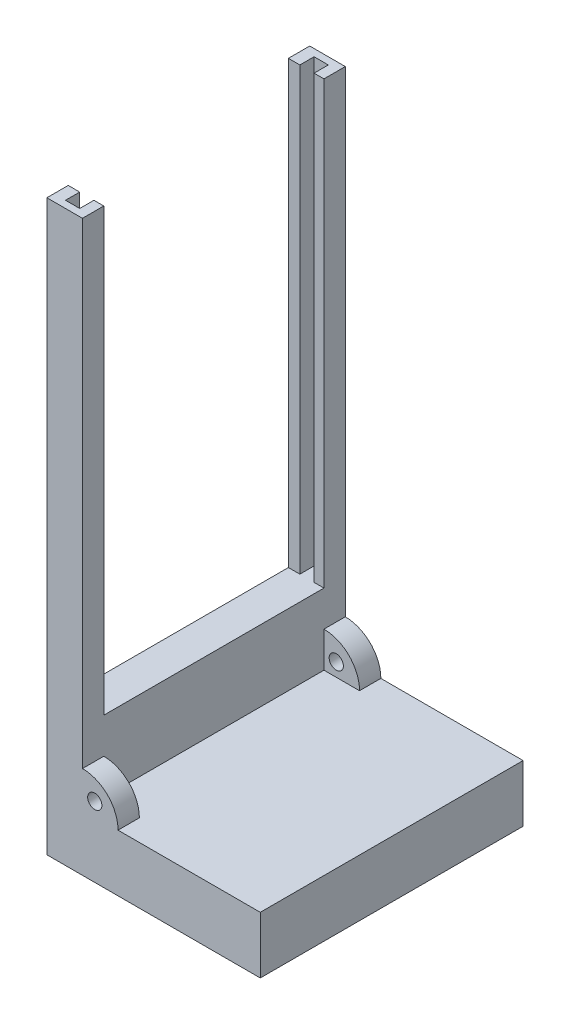
from build123d import *

# Parameters (mm, degrees)
SKETCH1_W           = 369.515011548
SKETCH1_H           = 800
BOSS_EXTRUDE1_DEPTH = 80
SKETCH2_W           = 369.515011548
SKETCH2_H           = 80
BOSS_EXTRUDE2_DEPTH = 250
SKETCH3_W           = 50
SKETCH3_H           = 50
BOSS_EXTRUDE3_DEPTH = 30
SKETCH4_W           = 50
SKETCH4_H           = 50
BOSS_EXTRUDE4_DEPTH = 30
SKETCH5_W           = 309.515011548
SKETCH5_H           = 650
CUT_EXTRUDE1_DEPTH  = 507.591883018
SKETCH6_W           = 369.515011548
SKETCH6_H           = 800
CUT_EXTRUDE2_DEPTH  = 30
SKETCH7_W           = 20
SKETCH7_H           = 620
CUT_EXTRUDE3_DEPTH  = 20
FILLET1_R           = 50
SKETCH8_R           = 10
CUT_EXTRUDE4_DEPTH  = 637.742761057
CUT_EXTRUDE5_DEPTH  = 10


with BuildPart() as part:
    # Sketch1 → Boss-Extrude1 (new body)
    with BuildSketch(Plane(origin=(0, 0, 0), x_dir=(0, 0, -1), z_dir=(1, 0, 0))):
        Rectangle(SKETCH1_W, SKETCH1_H)
    extrude(amount=BOSS_EXTRUDE1_DEPTH)

    # Sketch2 → Boss-Extrude2 (add)
    with BuildSketch(Plane(origin=(80, 0, 0), x_dir=(0, 0, -1), z_dir=(1, 0, 0))):
        with Locations((0, -360)):
            Rectangle(SKETCH2_W, SKETCH2_H)
    extrude(amount=BOSS_EXTRUDE2_DEPTH)

    # Sketch3 → Boss-Extrude3 (add)
    with BuildSketch(Plane(origin=(0, 0, -184.757505774), x_dir=(-1, 0, 0), z_dir=(0, 0, -1))):
        with Locations((-105, -295)):
            Rectangle(SKETCH3_W, SKETCH3_H)
    extrude(amount=-BOSS_EXTRUDE3_DEPTH)

    # Sketch4 → Boss-Extrude4 (add)
    with BuildSketch(Plane.XY.offset(184.757505774)):
        with Locations((105, -295)):
            Rectangle(SKETCH4_W, SKETCH4_H)
    extrude(amount=-BOSS_EXTRUDE4_DEPTH)

    # Sketch5 → Cut-Extrude1 (cut, through all)
    with BuildSketch(Plane(origin=(80, 0, 0), x_dir=(0, 0, -1), z_dir=(1, 0, 0))):
        with Locations((0, 105)):
            Rectangle(SKETCH5_W, SKETCH5_H)
    extrude(amount=-CUT_EXTRUDE1_DEPTH, mode=Mode.SUBTRACT)

    # Sketch6 → Cut-Extrude2 (cut)
    with BuildSketch(Plane.ZY):
        Rectangle(SKETCH6_W, SKETCH6_H)
    extrude(amount=-CUT_EXTRUDE2_DEPTH, mode=Mode.SUBTRACT)

    # Sketch7 → Cut-Extrude3 (cut)
    with BuildSketch(Plane(origin=(0, 0, 154.757505774), x_dir=(-1, 0, 0), z_dir=(0, 0, -1))):
        with Locations((-56.133818704, 90)):
            Rectangle(SKETCH7_W, SKETCH7_H)
    cut_extrude3 = extrude(amount=-CUT_EXTRUDE3_DEPTH, mode=Mode.SUBTRACT)

    # Mirror1: Cut-Extrude3 across plane
    add(cut_extrude3.mirror(Plane.XY), mode=Mode.SUBTRACT)

    # Fillet1
    fillet1_edges = [part.edges().sort_by_distance(p)[0] for p in [
        (130, -270, 169.757505774),
        (130, -270, -169.757505774),
    ]]
    fillet(fillet1_edges, radius=FILLET1_R - 0.0001)  # a hair under: the kernel refuses the full size

    # Sketch8 → Cut-Extrude4 (cut, through all)
    with BuildSketch(Plane(origin=(0, 0, -184.757505774), x_dir=(-1, 0, 0), z_dir=(0, 0, -1))):
        with Locations(Location((-97.304869152, -301.216000224, 0), (0, 0, 90))):
            Circle(SKETCH8_R)
    extrude(amount=-CUT_EXTRUDE4_DEPTH, mode=Mode.SUBTRACT)

    # Sketch9 → Cut-Extrude5 (cut)
    # profile 1 of 6: a face of its own
    with BuildSketch(Plane.ZY.offset(-30)):
        with BuildLine():
            Line((-80.52924599, -289.320103921), (-80.52924599, -294.904029521))
            Line((-80.52924599, -294.904029521), (-81.15743762, -294.904029521))
            add(Edge.make_bspline(
                [(-81.15743762, -294.904029521), (-81.413574392, -294.909873211), (-81.881949181, -294.920559054), (-82.518671526, -295.01445331), (-83.009872361, -295.193475663), (-83.401812393, -295.45647266), (-83.633732743, -295.911747878), (-83.77293967, -296.527311888), (-83.863885332, -297.347529546), (-83.873974769, -297.9633239), (-83.87960135, -298.306734184)],
                knots=[0, 0, 0, 0, 1.170341667, 2.140100881, 2.922261751, 3.549365504, 4.239834367, 5.187221071, 6.431396451, 8, 8, 8, 8], degree=3))
            Line((-83.87960135, -298.306734184), (-83.87960135, -305.513488162))
            Line((-83.87960135, -305.513488162), (-72.711750149, -305.513488162))
            Line((-72.711750149, -305.513488162), (-72.711750149, -298.306734184))
            add(Edge.make_bspline(
                [(-72.711750149, -298.306734184), (-72.717756838, -297.963394695), (-72.728527876, -297.347727287), (-72.815562595, -296.526015241), (-72.965604493, -295.910203153), (-73.207677304, -295.455009043), (-73.606359428, -295.19597845), (-74.0985174, -295.013834996), (-74.735690903, -294.920767956), (-75.203992037, -294.909947065), (-75.46008853, -294.904029521)],
                knots=[0, 0, 0, 0, 1.564511131, 2.805440511, 3.753787037, 4.449178313, 5.085362303, 5.86548255, 6.832711704, 8, 8, 8, 8], degree=3))
            Line((-75.46008853, -294.904029521), (-76.062105509, -294.904029521))
            Line((-76.062105509, -294.904029521), (-76.062105509, -289.320103921))
            Line((-76.062105509, -289.320103921), (-53.726403108, -289.320103921))
            Line((-53.726403108, -289.320103921), (-53.726403108, -294.904029521))
            Line((-53.726403108, -294.904029521), (-55.863999627, -294.904029521))
            add(Edge.make_bspline(
                [(-55.863999627, -294.904029521), (-56.198468051, -294.910634354), (-56.802254166, -294.922557471), (-57.617456501, -295.005046872), (-58.234184925, -295.17131606), (-58.715407673, -295.411134441), (-59.013794603, -295.861836088), (-59.181820064, -296.486796078), (-59.302638072, -297.322162531), (-59.307575336, -297.954241664), (-59.310328708, -298.306734184)],
                knots=[0, 0, 0, 0, 1.359249953, 2.453733113, 3.313690376, 3.953962847, 4.580132613, 5.435616196, 6.56991623, 8, 8, 8, 8], degree=3))
            Line((-59.310328708, -298.306734184), (-59.310328708, -320.380690073))
            add(Edge.make_bspline(
                [(-59.310328708, -320.380690073), (-59.307490138, -320.744720646), (-59.302382213, -321.399783021), (-59.181167017, -322.270348771), (-59.013065313, -322.923957755), (-58.722954044, -323.405175662), (-58.23495632, -323.656314607), (-57.618504333, -323.831317882), (-56.802786867, -323.924699637), (-56.198529406, -323.934832741), (-55.863999627, -323.940442643)],
                knots=[0, 0, 0, 0, 1.444986881, 2.600211651, 3.481122194, 4.122029754, 4.75412861, 5.598518326, 6.670488681, 8, 8, 8, 8], degree=3))
            Line((-55.863999627, -323.940442643), (-53.726403108, -323.940442643))
            Line((-53.726403108, -323.940442643), (-53.726403108, -329.524368244))
            Line((-53.726403108, -329.524368244), (-76.062105509, -329.524368244))
            Line((-76.062105509, -329.524368244), (-76.062105509, -323.940442643))
            Line((-76.062105509, -323.940442643), (-75.46008853, -323.940442643))
            add(Edge.make_bspline(
                [(-75.46008853, -323.940442643), (-75.206640119, -323.935739606), (-74.743137858, -323.92713877), (-74.113123667, -323.819945929), (-73.618558733, -323.633492364), (-73.225287202, -323.349298341), (-72.970339825, -322.881923123), (-72.827003452, -322.232330425), (-72.725066545, -321.378446265), (-72.716491031, -320.735909617), (-72.711750149, -320.380690073)],
                knots=[0, 0, 0, 0, 1.127981357, 2.062833636, 2.830046389, 3.467313527, 4.175874923, 5.140314235, 6.419053172, 8, 8, 8, 8], degree=3))
            Line((-72.711750149, -320.380690073), (-72.711750149, -311.097413762))
            Line((-72.711750149, -311.097413762), (-83.87960135, -311.097413762))
            Line((-83.87960135, -311.097413762), (-83.87960135, -320.380690073))
            add(Edge.make_bspline(
                [(-83.87960135, -320.380690073), (-83.87332423, -320.735647516), (-83.861975895, -321.377371156), (-83.776558725, -322.233724562), (-83.626477045, -322.878485857), (-83.38461309, -323.35167521), (-82.991506635, -323.630768401), (-82.502603814, -323.822135889), (-81.874092924, -323.926553039), (-81.410781616, -323.935532545), (-81.15743762, -323.940442643)],
                knots=[0, 0, 0, 0, 1.584921005, 2.86536118, 3.832224895, 4.536010505, 5.174879603, 5.931980822, 6.869183128, 8, 8, 8, 8], degree=3))
            Line((-81.15743762, -323.940442643), (-80.52924599, -323.940442643))
            Line((-80.52924599, -323.940442643), (-80.52924599, -329.524368244))
            Line((-80.52924599, -329.524368244), (-102.864948391, -329.524368244))
            Line((-102.864948391, -329.524368244), (-102.864948391, -323.940442643))
            Line((-102.864948391, -323.940442643), (-100.74480164, -323.940442643))
            add(Edge.make_bspline(
                [(-100.74480164, -323.940442643), (-100.422003706, -323.932919392), (-99.836037888, -323.919262649), (-99.042528449, -323.845777338), (-98.431370031, -323.691914944), (-98.017414176, -323.512208645), (-97.789499261, -323.281937277), (-97.649795124, -323.05537615), (-97.530498169, -322.766820489), (-97.435429653, -322.411995948), (-97.371005024, -321.993393897), (-97.319615598, -321.513003602), (-97.28267883, -320.968720141), (-97.281596318, -320.584339309), (-97.281022791, -320.380690073)],
                knots=[0, 0, 0, 0, 1.913556319, 3.473623831, 4.702143021, 5.649843125, 6.088398027, 6.599755281, 7.217327896, 7.93203303, 8.770386788, 9.723551885, 10.793912496, 12, 12, 12, 12], degree=3))
            Line((-97.281022791, -320.380690073), (-97.281022791, -298.306734184))
            add(Edge.make_bspline(
                [(-97.281022791, -298.306734184), (-97.28392296, -297.951401117), (-97.289128129, -297.313655854), (-97.408345595, -296.471789736), (-97.578079305, -295.845156743), (-97.873825502, -295.392869591), (-98.356567814, -295.165370782), (-98.974367129, -295.00432048), (-99.795054446, -294.922965354), (-100.407460356, -294.910755351), (-100.74480164, -294.904029521)],
                knots=[0, 0, 0, 0, 1.43500274, 2.575516569, 3.426914014, 4.050092937, 4.681533541, 5.522888741, 6.635493423, 8, 8, 8, 8], degree=3))
            Line((-100.74480164, -294.904029521), (-102.864948391, -294.904029521))
            Line((-102.864948391, -294.904029521), (-102.864948391, -289.320103921))
            Line((-102.864948391, -289.320103921), (-80.52924599, -289.320103921))
        make_face()
    # profile 2 of 6: a face of its own
    with BuildSketch(Plane.ZY.offset(-30)):
        with BuildLine():
            add(Edge.make_bspline(
                [(-34.269912344, -299.929562562), (-33.614924706, -299.938809967), (-32.339472031, -299.956817372), (-30.479717904, -300.168543041), (-28.724226392, -300.482034678), (-27.073356713, -300.936369193), (-25.532564259, -301.523876988), (-24.088075572, -302.228311142), (-22.759646969, -303.082053986), (-21.534452576, -304.048989561), (-20.437652519, -305.128671423), (-19.472920761, -306.30578584), (-18.672794143, -307.58480894), (-18.009587013, -308.953171137), (-17.495868319, -310.413829254), (-17.130740067, -311.969691557), (-16.908099359, -313.618240279), (-16.884554426, -314.749515849), (-16.872494145, -315.328982381)],
                knots=[0, 0, 0, 0, 1.196542578, 2.330018677, 3.416363756, 4.453179253, 5.454182637, 6.426435122, 7.384873258, 8.334545639, 9.274213712, 10.19236266, 11.109634181, 12.02490141, 12.966341792, 13.933290936, 14.941381954, 16, 16, 16, 16], degree=3))
            add(Edge.make_bspline(
                [(-16.872494145, -315.328982381), (-16.884496182, -315.905558712), (-16.907925001, -317.031076229), (-17.1317004, -318.673561142), (-17.494316471, -320.220527279), (-18.005866172, -321.677269043), (-18.656077251, -323.043128748), (-19.471176866, -324.307444186), (-20.41600506, -325.485967877), (-21.509057505, -326.556034459), (-22.724456619, -327.515420911), (-24.048686095, -328.360509086), (-25.48477417, -329.06452285), (-27.025270247, -329.642629706), (-28.66908821, -330.095886098), (-30.423636361, -330.415370564), (-32.282029029, -330.609881864), (-33.556894709, -330.630572529), (-34.208838157, -330.641153364)],
                knots=[0, 0, 0, 0, 1.057596641, 2.064502968, 3.035390092, 3.968823438, 4.89262528, 5.804619524, 6.723149214, 7.659096689, 8.605139245, 9.560112019, 10.536324081, 11.53452228, 12.575560294, 13.661081178, 14.803918854, 16, 16, 16, 16], degree=3))
            add(Edge.make_bspline(
                [(-34.208838157, -330.641153364), (-34.866594852, -330.630628164), (-36.150165571, -330.610088901), (-38.020216903, -330.415670163), (-39.779687726, -330.095365635), (-41.428715319, -329.648887277), (-42.974440436, -329.088102479), (-44.401481864, -328.376029058), (-45.71869228, -327.541475175), (-46.92953937, -326.594260262), (-47.997190926, -325.516861293), (-48.946029678, -324.352413103), (-49.727884268, -323.077107505), (-50.384434195, -321.71499611), (-50.87596926, -320.25051117), (-51.233978638, -318.693334397), (-51.457106035, -317.042607823), (-51.48075176, -315.908448593), (-51.492832867, -315.328982381)],
                knots=[0, 0, 0, 0, 1.206526372, 2.354460145, 3.445027256, 4.484462497, 5.485609056, 6.456858708, 7.40428996, 8.3426619, 9.270859129, 10.181715767, 11.092369193, 12.008881977, 12.950479951, 13.919969029, 14.937267682, 16, 16, 16, 16], degree=3))
            add(Edge.make_bspline(
                [(-51.492832867, -315.328982381), (-51.480777759, -314.746601714), (-51.457180817, -313.606636538), (-51.233635087, -311.947369472), (-50.877688092, -310.383708931), (-50.382388899, -308.914823038), (-49.72831821, -307.545971854), (-48.945721193, -306.262630731), (-48.000355851, -305.088963985), (-46.926710469, -304.011761282), (-45.719234224, -303.055590806), (-44.405810699, -302.212905879), (-42.981492943, -301.501984307), (-41.444454375, -300.928665194), (-39.803709194, -300.475809329), (-38.055190846, -300.155177439), (-36.199668818, -299.960251057), (-34.92477213, -299.939976654), (-34.269912344, -299.929562562)],
                knots=[0, 0, 0, 0, 1.067891802, 2.090315722, 3.064846734, 4.006292824, 4.927475274, 5.842519126, 6.757391874, 7.685439381, 8.626976171, 9.577119894, 10.543438007, 11.541290185, 12.581967327, 13.661866183, 14.79900087, 16, 16, 16, 16], degree=3))
        make_face()
        with BuildLine():
            add(Edge.make_bspline(
                [(-29.715523026, -315.30280773), (-29.719410232, -314.857810687), (-29.726856322, -314.005402011), (-29.76819606, -312.777363617), (-29.844925904, -311.656832001), (-29.95423331, -310.642996931), (-30.106113635, -309.738586374), (-30.271336013, -308.937088738), (-30.483274403, -308.244188044), (-30.714179743, -307.645210616), (-31.000494742, -307.142626569), (-31.315776166, -306.699662352), (-31.692767746, -306.337319668), (-32.111128026, -306.031560544), (-32.574110846, -305.797829299), (-33.084741934, -305.626757447), (-33.641338355, -305.535316257), (-34.028223447, -305.520879175), (-34.226287925, -305.513488162)],
                knots=[0, 0, 0, 0, 1.762070286, 3.375312315, 4.864463545, 6.208660635, 7.410836755, 8.495037169, 9.445841918, 10.277695196, 11.030463183, 11.730658853, 12.4228542, 13.090870761, 13.775844008, 14.467751919, 15.21557092, 16, 16, 16, 16], degree=3))
            add(Edge.make_bspline(
                [(-34.226287925, -305.513488162), (-34.421594452, -305.52025618), (-34.797264223, -305.533274382), (-35.340434731, -305.631482823), (-35.840481091, -305.792728423), (-36.291028649, -306.038018951), (-36.708361799, -306.330517252), (-37.064788738, -306.709414429), (-37.394849048, -307.136084459), (-37.664875987, -307.648975167), (-37.90303107, -308.241907256), (-38.098478192, -308.939254511), (-38.271805382, -309.737296779), (-38.407220052, -310.644147554), (-38.521630659, -311.656614798), (-38.596758229, -312.777429459), (-38.638577352, -314.005383169), (-38.645953365, -314.857804224), (-38.649803987, -315.30280773)],
                knots=[0, 0, 0, 0, 0.777112355, 1.494766332, 2.190415094, 2.858541341, 3.530169583, 4.209734623, 4.920632294, 5.671870148, 6.508220903, 7.460865152, 8.550927377, 9.757771781, 11.109236372, 12.606438809, 14.22840295, 16, 16, 16, 16], degree=3))
            add(Edge.make_bspline(
                [(-38.649803987, -315.30280773), (-38.645924667, -315.747808668), (-38.638493682, -316.600224803), (-38.59714848, -317.825312213), (-38.521103548, -318.943125719), (-38.407385694, -319.952818694), (-38.271810151, -320.856550753), (-38.100866966, -321.653632484), (-37.890707412, -322.34388795), (-37.661704773, -322.940994862), (-37.372213677, -323.441367492), (-37.048841238, -323.87696387), (-36.672017244, -324.244946369), (-36.248595901, -324.546690507), (-35.778100156, -324.773249683), (-35.265765094, -324.942947345), (-34.703692039, -325.036058226), (-34.313856336, -325.050026161), (-34.112864436, -325.057227763)],
                knots=[0, 0, 0, 0, 1.762186567, 3.375535054, 4.853296124, 6.197581918, 7.398015728, 8.471036754, 9.421904247, 10.25381242, 10.996609211, 11.703730689, 12.395971715, 13.073397001, 13.753265227, 14.456153815, 15.204022165, 16, 16, 16, 16], degree=3))
            add(Edge.make_bspline(
                [(-34.112864436, -325.057227763), (-33.917689798, -325.05001081), (-33.539411265, -325.036023241), (-32.99440165, -324.943285739), (-32.497420384, -324.771397995), (-32.04182182, -324.548046035), (-31.631706241, -324.253736817), (-31.270220731, -323.890557179), (-30.957879176, -323.45843864), (-30.679911567, -322.959742592), (-30.455044198, -322.367593274), (-30.25851225, -321.678110825), (-30.083479328, -320.880186281), (-29.947672089, -319.973555378), (-29.847473324, -318.959939216), (-29.766911423, -317.839963576), (-29.727181869, -316.608915817), (-29.719521144, -315.750705902), (-29.715523026, -315.30280773)],
                knots=[0, 0, 0, 0, 0.779089163, 1.509994885, 2.196411176, 2.87124698, 3.528380745, 4.20141725, 4.907189358, 5.650161873, 6.473560393, 7.428627967, 8.510123287, 9.731508912, 11.085167741, 12.574599581, 14.21228984, 16, 16, 16, 16], degree=3))
        make_face(mode=Mode.SUBTRACT)
    # profile 3 of 6: a face of its own
    with BuildSketch(Plane.ZY.offset(-30)):
        with BuildLine():
            add(Edge.make_bspline(
                [(-10.171783424, -297.652367903), (-10.176374927, -297.393052576), (-10.184737157, -296.920776966), (-10.291803928, -296.282560621), (-10.475676851, -295.784947219), (-10.760097228, -295.410329726), (-11.176663924, -295.165066544), (-11.723555881, -295.010005687), (-12.419995121, -294.921700145), (-12.934383739, -294.910292165), (-13.216767853, -294.904029521)],
                knots=[0, 0, 0, 0, 1.269504598, 2.312073363, 3.156180889, 3.846078898, 4.569593906, 5.48001558, 6.616603198, 8, 8, 8, 8], degree=3))
            Line((-13.216767853, -294.904029521), (-14.638923905, -294.904029521))
            Line((-14.638923905, -294.904029521), (-14.638923905, -289.320103921))
            Line((-14.638923905, -289.320103921), (2.112852896, -289.320103921))
            Line((2.112852896, -289.320103921), (2.112852896, -321.192104262))
            add(Edge.make_bspline(
                [(2.112852896, -321.192104262), (2.119818506, -321.454533003), (2.13245223, -321.930507455), (2.252214541, -322.573509023), (2.439718722, -323.078734963), (2.747599135, -323.458450028), (3.208317963, -323.690320442), (3.809415816, -323.830847981), (4.576343285, -323.924117195), (5.142974098, -323.934651394), (5.454483373, -323.940442643)],
                knots=[0, 0, 0, 0, 1.217008097, 2.207322101, 3.024692249, 3.695432487, 4.420627304, 5.370349588, 6.554331187, 8, 8, 8, 8], degree=3))
            Line((5.454483373, -323.940442643), (6.579993377, -323.940442643))
            Line((6.579993377, -323.940442643), (6.579993377, -329.524368244))
            Line((6.579993377, -329.524368244), (-14.638923905, -329.524368244))
            Line((-14.638923905, -329.524368244), (-14.638923905, -323.940442643))
            Line((-14.638923905, -323.940442643), (-13.216767853, -323.940442643))
            add(Edge.make_bspline(
                [(-13.216767853, -323.940442643), (-12.934484173, -323.934036802), (-12.420278504, -323.922367974), (-11.722727331, -323.835647814), (-11.180364046, -323.676652478), (-10.754360545, -323.443737403), (-10.479046757, -323.059344579), (-10.290877303, -322.562759988), (-10.185053029, -321.923405977), (-10.176486889, -321.451317073), (-10.171783424, -321.192104262)],
                knots=[0, 0, 0, 0, 1.3827462, 2.518799289, 3.428792798, 4.144495218, 4.845303441, 5.689013988, 6.731092441, 8, 8, 8, 8], degree=3))
            Line((-10.171783424, -321.192104262), (-10.171783424, -297.652367903))
        make_face()
    # profile 4 of 6: a face of its own
    with BuildSketch(Plane.ZY.offset(-30)):
        with BuildLine():
            add(Edge.make_bspline(
                [(27.240518098, -297.469145344), (27.226012653, -297.230217505), (27.199233759, -296.78912637), (27.07996324, -296.188068327), (26.867553917, -295.718780551), (26.582470837, -295.348163423), (26.15849336, -295.106301984), (25.613348339, -294.949332378), (24.925366109, -294.860889612), (24.419725817, -294.849296024), (24.143184367, -294.842955335)],
                knots=[0, 0, 0, 0, 1.202278255, 2.21955835, 3.056222916, 3.772649999, 4.526809247, 5.460173051, 6.610934614, 8, 8, 8, 8], degree=3))
            add(Edge.make_bspline(
                [(24.143184367, -294.842955335), (24.05881165, -294.845232148), (23.840401698, -294.851125979), (23.486259183, -294.881356045), (23.113718818, -294.894717061), (22.875168778, -294.901244298), (22.773377618, -294.904029521)],
                knots=[0, 0, 0, 0, 0.73848466, 1.911665333, 3.108891333, 4, 4, 4, 4], degree=3))
            Line((22.773377618, -294.904029521), (22.773377618, -289.320103921))
            Line((22.773377618, -289.320103921), (39.525154419, -289.320103921))
            Line((39.525154419, -289.320103921), (39.525154419, -321.017606587))
            add(Edge.make_bspline(
                [(39.525154419, -321.017606587), (39.53941178, -321.300252547), (39.565286819, -321.813213892), (39.682013839, -322.500938338), (39.853724434, -323.030958937), (40.113037588, -323.429090241), (40.508643561, -323.678293685), (41.020856917, -323.834507583), (41.674346536, -323.922748557), (42.156880642, -323.9341711), (42.421815824, -323.940442643)],
                knots=[0, 0, 0, 0, 1.383894081, 2.511566656, 3.402729337, 4.097523758, 4.784256796, 5.639238454, 6.703824698, 8, 8, 8, 8], degree=3))
            Line((42.421815824, -323.940442643), (43.992294899, -323.940442643))
            Line((43.992294899, -323.940442643), (43.992294899, -329.524368244))
            Line((43.992294899, -329.524368244), (28.03448252, -329.524368244))
            Line((28.03448252, -329.524368244), (28.03448252, -326.112938697))
            add(Edge.make_bspline(
                [(28.03448252, -326.112938697), (27.692563075, -326.489375643), (27.031795839, -327.21684875), (25.959481402, -328.155949885), (24.89616543, -328.95431873), (23.806985844, -329.584738713), (22.682627175, -330.065520059), (21.497514562, -330.396399672), (20.247350554, -330.600950832), (19.38891563, -330.627590741), (18.951878535, -330.641153364)],
                knots=[0, 0, 0, 0, 1.161328025, 2.244293276, 3.251947254, 4.195902851, 5.113155777, 6.038918058, 7.001595195, 8, 8, 8, 8], degree=3))
            add(Edge.make_bspline(
                [(18.951878535, -330.641153364), (18.480222326, -330.629243418), (17.565509899, -330.606145715), (16.233866164, -330.43265089), (14.993943823, -330.127956679), (13.839508887, -329.704248656), (12.764325845, -329.177668098), (11.792016467, -328.50345038), (10.90162284, -327.721696839), (10.102167035, -326.817167066), (9.408640712, -325.78771153), (8.790104241, -324.654455027), (8.278960534, -323.400519238), (7.863884306, -322.032320836), (7.531760809, -320.554132138), (7.300997644, -318.961650594), (7.159449936, -317.256867573), (7.145549639, -316.082520668), (7.138385937, -315.477305405)],
                knots=[0, 0, 0, 0, 1.033401257, 2.004139786, 2.936200397, 3.825352621, 4.694640756, 5.551979022, 6.409909266, 7.285830176, 8.189121989, 9.124488562, 10.110359953, 11.150557979, 12.254498641, 13.427092177, 14.674017808, 16, 16, 16, 16], degree=3))
            add(Edge.make_bspline(
                [(7.138385937, -315.477305405), (7.149764198, -314.898343584), (7.171982677, -313.767797316), (7.306143653, -312.116791591), (7.556320458, -310.559234159), (7.877212065, -309.08790945), (8.321819261, -307.714646124), (8.836577, -306.422943019), (9.473946346, -305.234406479), (10.181609766, -304.131406566), (10.98423338, -303.148952013), (11.850653783, -302.282363331), (12.7903613, -301.55585897), (13.790986957, -300.951189163), (14.867006412, -300.501735326), (15.997344811, -300.163622645), (17.197543079, -299.972187789), (18.017664365, -299.943986129), (18.437110394, -299.929562562)],
                knots=[0, 0, 0, 0, 1.289015847, 2.517077983, 3.68371469, 4.798912746, 5.865717118, 6.893699514, 7.890019213, 8.863353647, 9.806792045, 10.708705139, 11.585471447, 12.444902062, 13.303551908, 14.174249062, 15.066230819, 16, 16, 16, 16], degree=3))
            add(Edge.make_bspline(
                [(18.437110394, -299.929562562), (18.876639859, -299.942830042), (19.738502546, -299.968845923), (20.99876729, -300.127286087), (22.182689152, -300.432211522), (23.305611633, -300.833048922), (24.368871765, -301.36001266), (25.374692502, -302.018174086), (26.355682546, -302.771162092), (26.941932331, -303.368370522), (27.240518098, -303.672537691)],
                knots=[0, 0, 0, 0, 1.070241697, 2.098611029, 3.084270401, 4.040606829, 4.996838418, 5.965052021, 6.963570616, 8, 8, 8, 8], degree=3))
            Line((27.240518098, -303.672537691), (27.240518098, -297.469145344))
        make_face()
        with BuildLine():
            add(Edge.make_bspline(
                [(27.161994144, -315.320257498), (27.157167923, -314.907275897), (27.147887708, -314.113164463), (27.118548595, -312.963571631), (27.046878667, -311.901734919), (26.953506936, -310.923656504), (26.831335304, -310.033087481), (26.689456455, -309.227061658), (26.501665297, -308.512932404), (26.307920543, -307.875539198), (26.067855609, -307.323239039), (25.811880854, -306.837469797), (25.510869622, -306.429751764), (25.180450198, -306.0948282), (24.81441952, -305.833884015), (24.41760875, -305.651456622), (23.990383702, -305.529388271), (23.69326287, -305.518871615), (23.541167388, -305.513488162)],
                knots=[0, 0, 0, 0, 1.73649156, 3.339053847, 4.834024974, 6.210105528, 7.469014107, 8.612997512, 9.64801898, 10.572234746, 11.410338462, 12.176395472, 12.875831354, 13.532944045, 14.147008277, 14.754216713, 15.362286351, 16, 16, 16, 16], degree=3))
            add(Edge.make_bspline(
                [(23.541167388, -305.513488162), (23.394872255, -305.519064816), (23.106350635, -305.530063032), (22.690968534, -305.651982653), (22.299713746, -305.833177923), (21.945534371, -306.105322666), (21.622725282, -306.4475649), (21.335233029, -306.865335597), (21.072513684, -307.350750521), (20.836111277, -307.910984243), (20.643010753, -308.553972505), (20.453788449, -309.270656734), (20.31207817, -310.076716288), (20.190492403, -310.964432033), (20.0963952, -311.936607795), (20.024874741, -312.989741942), (19.995601745, -314.127704778), (19.986258564, -314.913092294), (19.981414818, -315.320257498)],
                knots=[0, 0, 0, 0, 0.616611098, 1.216073493, 1.81540983, 2.430057194, 3.090910307, 3.796872339, 4.567023278, 5.420918686, 6.361791028, 7.402343814, 8.552440847, 9.818077232, 11.189278219, 12.679972322, 14.278811777, 16, 16, 16, 16], degree=3))
            add(Edge.make_bspline(
                [(19.981414818, -315.320257498), (19.986312233, -315.715790142), (19.995820732, -316.483730264), (20.02463777, -317.595528721), (20.096300838, -318.628383313), (20.192288946, -319.582710107), (20.308249859, -320.463415177), (20.469031912, -321.262357122), (20.638457306, -321.987583426), (20.847483855, -322.631831785), (21.081731571, -323.201685811), (21.340173725, -323.698254469), (21.64135902, -324.111327804), (21.961915173, -324.458121407), (22.318100476, -324.724223413), (22.696689021, -324.921078859), (23.109402926, -325.040746295), (23.394954688, -325.051646479), (23.541167388, -325.057227763)],
                knots=[0, 0, 0, 0, 1.684713162, 3.270928076, 4.735861596, 6.09282119, 7.355794366, 8.516935816, 9.562382911, 10.525966876, 11.397769368, 12.18466237, 12.903172076, 13.569041428, 14.188354303, 14.786624645, 15.378708484, 16, 16, 16, 16], degree=3))
            add(Edge.make_bspline(
                [(23.541167388, -325.057227763), (23.690295864, -325.051673909), (23.981580159, -325.040825876), (24.402512746, -324.920800129), (24.792777102, -324.725267124), (25.151756836, -324.451342602), (25.476353164, -324.103050838), (25.778196663, -323.685620352), (26.043790931, -323.188510789), (26.278565379, -322.6142949), (26.486747528, -321.966341599), (26.666056494, -321.242892825), (26.827473008, -320.443166596), (26.939529825, -319.564663177), (27.050564992, -318.611599369), (27.117236818, -317.583771245), (27.14818449, -316.477954161), (27.157275859, -315.715802798), (27.161994144, -315.320257498)],
                knots=[0, 0, 0, 0, 0.631710336, 1.233884401, 1.841352959, 2.476073464, 3.139915949, 3.856238553, 4.657468493, 5.526617269, 6.487268141, 7.544494808, 8.689985485, 9.949114244, 11.303238957, 12.763713306, 14.320415006, 16, 16, 16, 16], degree=3))
        make_face(mode=Mode.SUBTRACT)
    # profile 5 of 6: a face of its own
    with BuildSketch(Plane.ZY.offset(-30)):
        with BuildLine():
            add(Edge.make_bspline(
                [(77.495848502, -319.473302163), (77.404372425, -319.928758817), (77.225531701, -320.819201444), (76.838122953, -322.097377025), (76.368031655, -323.285000649), (75.817168343, -324.390454079), (75.169429463, -325.396199352), (74.454994237, -326.328804339), (73.631071451, -327.146061035), (72.743358983, -327.897651422), (71.752969885, -328.540673592), (70.686800782, -329.116963221), (69.519592729, -329.577181958), (68.27523923, -329.979818483), (66.937754283, -330.265080103), (65.516854616, -330.486740549), (64.006706832, -330.617380751), (62.969167218, -330.633090883), (62.436699148, -330.641153364)],
                knots=[0, 0, 0, 0, 1.074883391, 2.101455722, 3.086573179, 4.028942088, 4.955254846, 5.852159633, 6.742369115, 7.636236799, 8.539962828, 9.470595676, 10.436970722, 11.439802905, 12.494961599, 13.598494153, 14.767540859, 16, 16, 16, 16], degree=3))
            add(Edge.make_bspline(
                [(62.436699148, -330.641153364), (61.828242457, -330.631640965), (60.639802301, -330.613061309), (58.907170373, -330.403749948), (57.2700855, -330.083647389), (55.725382076, -329.645891801), (54.288205959, -329.053440177), (52.943075055, -328.34659596), (51.69747152, -327.506307705), (50.562615339, -326.534035763), (49.542705191, -325.456227785), (48.65400652, -324.276338826), (47.900199458, -323.0072391), (47.287637054, -321.642008199), (46.805004889, -320.186814054), (46.468890303, -318.636734903), (46.265875357, -316.997928717), (46.23940221, -315.876335525), (46.22586514, -315.30280773)],
                knots=[0, 0, 0, 0, 1.156312456, 2.258514327, 3.312575887, 4.325802086, 5.305397023, 6.262654653, 7.210442992, 8.15566321, 9.098356963, 10.026208851, 10.958400359, 11.898820993, 12.865787222, 13.867984346, 14.909791674, 16, 16, 16, 16], degree=3))
            add(Edge.make_bspline(
                [(46.22586514, -315.30280773), (46.239383871, -314.732178903), (46.26581856, -313.616364519), (46.469039487, -311.986325198), (46.804402321, -310.444609703), (47.291448456, -308.994149676), (47.898227185, -307.62681781), (48.652792578, -306.352115066), (49.555304448, -305.178470993), (50.569832412, -304.084624521), (51.716104924, -303.114915919), (52.947940759, -302.24943096), (54.285781908, -301.532273539), (55.715098679, -300.951098642), (57.231196635, -300.480638499), (58.846506382, -300.168798847), (60.552312838, -299.957107147), (61.723480736, -299.938891443), (62.32327566, -299.929562562)],
                knots=[0, 0, 0, 0, 1.08939574, 2.130217366, 3.131345753, 4.097242782, 5.046813071, 5.983054421, 6.918290503, 7.869126648, 8.826283074, 9.779888485, 10.739024521, 11.717736454, 12.722570203, 13.764872372, 14.855315105, 16, 16, 16, 16], degree=3))
            add(Edge.make_bspline(
                [(62.32327566, -299.929562562), (62.911347995, -299.939710636), (64.055919302, -299.959461939), (65.718954154, -300.157925157), (67.280284775, -300.465340895), (68.737091169, -300.910734181), (70.086466084, -301.485928665), (71.327794243, -302.191919803), (72.471908811, -303.013247994), (73.501842888, -303.969354961), (74.423671992, -305.038371377), (75.2238163, -306.222740453), (75.883111321, -307.525821867), (76.435841401, -308.926911239), (76.864115725, -310.440887288), (77.163162389, -312.064921606), (77.349936957, -313.79777218), (77.371403217, -314.988220923), (77.382425013, -315.599453778)],
                knots=[0, 0, 0, 0, 1.139188137, 2.217213728, 3.240763115, 4.219526117, 5.163848219, 6.077549891, 6.981728026, 7.887117431, 8.794329465, 9.711934046, 10.649639668, 11.618813758, 12.626804757, 13.693529404, 14.815748586, 16, 16, 16, 16], degree=3))
            Line((77.382425013, -315.599453778), (77.382425013, -316.681339363))
            Line((77.382425013, -316.681339363), (58.51050146, -316.681339363))
            Line((58.51050146, -316.681339363), (58.51050146, -317.300806109))
            add(Edge.make_bspline(
                [(58.51050146, -317.300806109), (58.515722826, -317.603444403), (58.525878637, -318.192090741), (58.598717734, -319.048093703), (58.703184282, -319.855401366), (58.884745715, -320.601581885), (59.087917906, -321.299817261), (59.353284869, -321.937448846), (59.656718237, -322.528247477), (60.015013527, -323.060125208), (60.414490338, -323.533260433), (60.859886936, -323.93957354), (61.337858178, -324.293713693), (61.867074969, -324.570846299), (62.428900443, -324.790068741), (63.028095412, -324.95071386), (63.670413807, -325.033672859), (64.111669913, -325.049225141), (64.338723806, -325.057227763)],
                knots=[0, 0, 0, 0, 1.321312732, 2.570018128, 3.749992399, 4.871307272, 5.919855267, 6.922162427, 7.882141543, 8.815544038, 9.716413745, 10.579242415, 11.442911822, 12.306487853, 13.179074711, 14.072393591, 15.00812582, 16, 16, 16, 16], degree=3))
            add(Edge.make_bspline(
                [(64.338723806, -325.057227763), (64.718566452, -325.042503317), (65.453838772, -325.014000783), (66.503961862, -324.73525279), (67.44505232, -324.27698921), (68.271563382, -323.633868339), (68.975051166, -322.820736499), (69.539386662, -321.843205791), (69.995497205, -320.719760476), (70.171025887, -319.901620461), (70.262919873, -319.473302163)],
                knots=[0, 0, 0, 0, 1.017644018, 1.969882752, 2.891398603, 3.809370978, 4.760937758, 5.758173919, 6.826343761, 8, 8, 8, 8], degree=3))
            Line((70.262919873, -319.473302163), (77.495848502, -319.473302163))
        make_face()
        with BuildLine():
            Line((58.51050146, -311.097413762), (67.444782421, -311.097413762))
            Line((67.444782421, -311.097413762), (67.444782421, -310.704793994))
            add(Edge.make_bspline(
                [(67.444782421, -310.704793994), (67.43503028, -310.310733176), (67.416564865, -309.564589646), (67.182173715, -308.519198828), (66.82345668, -307.608003093), (66.296409536, -306.852005634), (65.644230322, -306.241860297), (64.847506212, -305.815532868), (63.92975859, -305.558975128), (63.276049954, -305.529112724), (62.934017522, -305.513488162)],
                knots=[0, 0, 0, 0, 1.208799935, 2.288830076, 3.274812217, 4.199665979, 5.097963363, 5.993945314, 6.950395138, 8, 8, 8, 8], degree=3))
            add(Edge.make_bspline(
                [(62.934017522, -305.513488162), (62.600128336, -305.526958016), (61.957119797, -305.552898453), (61.056458402, -305.844376687), (60.27067856, -306.30576885), (59.625459594, -306.962633835), (59.114841756, -307.778412254), (58.761561137, -308.753423287), (58.541654801, -309.874848971), (58.52127626, -310.674573376), (58.51050146, -311.097413762)],
                knots=[0, 0, 0, 0, 0.989892863, 1.90634974, 2.783083043, 3.676093857, 4.616844486, 5.624195273, 6.743834524, 8, 8, 8, 8], degree=3))
        make_face(mode=Mode.SUBTRACT)
    # profile 6 of 6: a face of its own
    with BuildSketch(Plane.ZY.offset(-30)):
        with BuildLine():
            add(Edge.make_bspline(
                [(96.175824612, -303.724886993), (96.42834319, -303.419556756), (96.918373379, -302.827041803), (97.742076824, -302.053462334), (98.596296877, -301.395084742), (99.493205124, -300.854170194), (100.431384208, -300.44669997), (101.398320885, -300.143805577), (102.401785824, -299.966209526), (103.082339083, -299.94186377), (103.426203009, -299.929562562)],
                knots=[0, 0, 0, 0, 1.119949045, 2.173340457, 3.188644809, 4.166455502, 5.127966172, 6.075220944, 7.027464678, 8, 8, 8, 8], degree=3))
            add(Edge.make_bspline(
                [(103.426203009, -299.929562562), (103.68530563, -299.933625835), (104.190541553, -299.941548997), (104.929307419, -300.031423448), (105.630628458, -300.178511663), (106.290826733, -300.386822456), (106.91142805, -300.651000906), (107.490450355, -300.975927223), (108.030913702, -301.359832977), (108.530103909, -301.798932506), (108.982163172, -302.280705857), (109.369196509, -302.814003171), (109.704144278, -303.381832471), (109.972738559, -303.994815499), (110.184040908, -304.64363151), (110.328483018, -305.331232128), (110.431983443, -306.057121468), (110.437950758, -306.557173907), (110.441009544, -306.813495841)],
                knots=[0, 0, 0, 0, 1.121123327, 2.186129097, 3.215797517, 4.219192765, 5.177998873, 6.130585632, 7.087737198, 8.042318558, 9.004425212, 9.941156089, 10.88907246, 11.852907377, 12.832321258, 13.837373772, 14.891459187, 16, 16, 16, 16], degree=3))
            add(Edge.make_bspline(
                [(110.441009544, -306.813495841), (110.423543917, -307.242663354), (110.389985587, -308.067262693), (110.107093122, -309.240462617), (109.633966766, -310.283441879), (108.964726294, -311.168244309), (108.147352523, -311.887360739), (107.189911474, -312.402299389), (106.109639254, -312.717130531), (105.347879634, -312.753658765), (104.953057665, -312.772591442)],
                knots=[0, 0, 0, 0, 1.128478141, 2.168249698, 3.154717077, 4.122350599, 5.066472116, 5.998190789, 6.962457142, 8, 8, 8, 8], degree=3))
            add(Edge.make_bspline(
                [(104.953057665, -312.772591442), (104.640218256, -312.758633503), (104.031223198, -312.731462004), (103.163201979, -312.487242844), (102.373660115, -312.095392591), (101.685042312, -311.554710663), (101.09769973, -310.907893755), (100.701818371, -310.14716597), (100.42428145, -309.324954375), (100.401614912, -308.744128064), (100.389943464, -308.445049102)],
                knots=[0, 0, 0, 0, 1.068381232, 2.079785568, 3.058710243, 4.065749455, 5.05977747, 6.021408088, 6.981183866, 8, 8, 8, 8], degree=3))
            add(Edge.make_bspline(
                [(100.389943464, -308.445049102), (100.396662299, -308.241117499), (100.409809407, -307.842073503), (100.512132148, -307.261315088), (100.702997556, -306.725513902), (100.942485843, -306.219326229), (101.277262303, -305.759911024), (101.677181352, -305.333236758), (102.155810729, -304.943022094), (102.515828708, -304.726707592), (102.702037657, -304.614825136)],
                knots=[0, 0, 0, 0, 1.037717152, 2.030557263, 2.985382954, 3.925294899, 4.869856449, 5.864570158, 6.895510309, 8, 8, 8, 8], degree=3))
            add(Edge.make_bspline(
                [(102.702037657, -304.614825136), (102.591971768, -304.581049733), (102.376583983, -304.514954694), (102.058129245, -304.449115154), (101.755577945, -304.397697778), (101.559283967, -304.39703016), (101.463104165, -304.396703042)],
                knots=[0, 0, 0, 0, 1.092850889, 2.138598386, 3.087953486, 4, 4, 4, 4], degree=3))
            add(Edge.make_bspline(
                [(101.463104165, -304.396703042), (101.276456788, -304.403138339), (100.90885462, -304.415812663), (100.371608227, -304.524514057), (99.862811552, -304.697959008), (99.385887374, -304.944539648), (98.948350784, -305.265776082), (98.530698221, -305.644442196), (98.148418066, -306.100383209), (97.804476168, -306.624954959), (97.485839398, -307.202883409), (97.220021998, -307.839200843), (96.992829489, -308.5281952), (96.799143649, -309.26429012), (96.664766912, -310.056291074), (96.560758746, -310.897567521), (96.48601065, -311.791173881), (96.482824243, -312.405986806), (96.481195543, -312.72024214)],
                knots=[0, 0, 0, 0, 0.828746329, 1.632216602, 2.425119257, 3.211252074, 4.007518064, 4.830804738, 5.711152074, 6.643110923, 7.614730241, 8.639722032, 9.702318609, 10.83705266, 12.018445352, 13.268799355, 14.603974746, 16, 16, 16, 16], degree=3))
            Line((96.481195543, -312.72024214), (96.481195543, -321.113580308))
            add(Edge.make_bspline(
                [(96.481195543, -321.113580308), (96.486510961, -321.378609075), (96.496201045, -321.861760422), (96.595319184, -322.515586759), (96.76069514, -323.027712824), (97.017530686, -323.423320396), (97.422197199, -323.669308944), (97.940026884, -323.822478871), (98.597359954, -323.927092419), (99.083629945, -323.935698572), (99.351682297, -323.940442643)],
                knots=[0, 0, 0, 0, 1.319001007, 2.404558276, 3.279283225, 3.986313006, 4.69718778, 5.580975007, 6.666532276, 8, 8, 8, 8], degree=3))
            Line((99.351682297, -323.940442643), (100.948336024, -323.940442643))
            Line((100.948336024, -323.940442643), (100.948336024, -329.524368244))
            Line((100.948336024, -329.524368244), (79.729418742, -329.524368244))
            Line((79.729418742, -329.524368244), (79.729418742, -323.940442643))
            Line((79.729418742, -323.940442643), (80.924727816, -323.940442643))
            add(Edge.make_bspline(
                [(80.924727816, -323.940442643), (81.230445152, -323.935240353), (81.788802152, -323.925738976), (82.539499675, -323.825821797), (83.125332664, -323.670724046), (83.576435755, -323.428845836), (83.874918971, -323.034782587), (84.070053429, -322.519754584), (84.17208932, -321.86196345), (84.187895459, -321.378551323), (84.196559222, -321.113580308)],
                knots=[0, 0, 0, 0, 1.420118957, 2.593681373, 3.508926753, 4.229804559, 4.922117477, 5.752831414, 6.768267266, 8, 8, 8, 8], degree=3))
            Line((84.196559222, -321.113580308), (84.196559222, -309.23028864))
            add(Edge.make_bspline(
                [(84.196559222, -309.23028864), (84.18779823, -308.982735165), (84.171812738, -308.531043864), (84.071113341, -307.918794865), (83.873840614, -307.442091775), (83.567755939, -307.088198898), (83.123444347, -306.865496984), (82.537102515, -306.731511955), (81.788602838, -306.635965027), (81.230482776, -306.632287786), (80.924727816, -306.630273282)],
                knots=[0, 0, 0, 0, 1.19155133, 2.174129728, 2.969824683, 3.643867903, 4.376520798, 5.31673007, 6.530024007, 8, 8, 8, 8], degree=3))
            Line((80.924727816, -306.630273282), (79.729418742, -306.630273282))
            Line((79.729418742, -306.630273282), (79.729418742, -301.046347682))
            Line((79.729418742, -301.046347682), (96.175824612, -301.046347682))
            Line((96.175824612, -301.046347682), (96.175824612, -303.724886993))
        make_face()
    extrude(amount=-CUT_EXTRUDE5_DEPTH, mode=Mode.SUBTRACT)


solid = part.part
